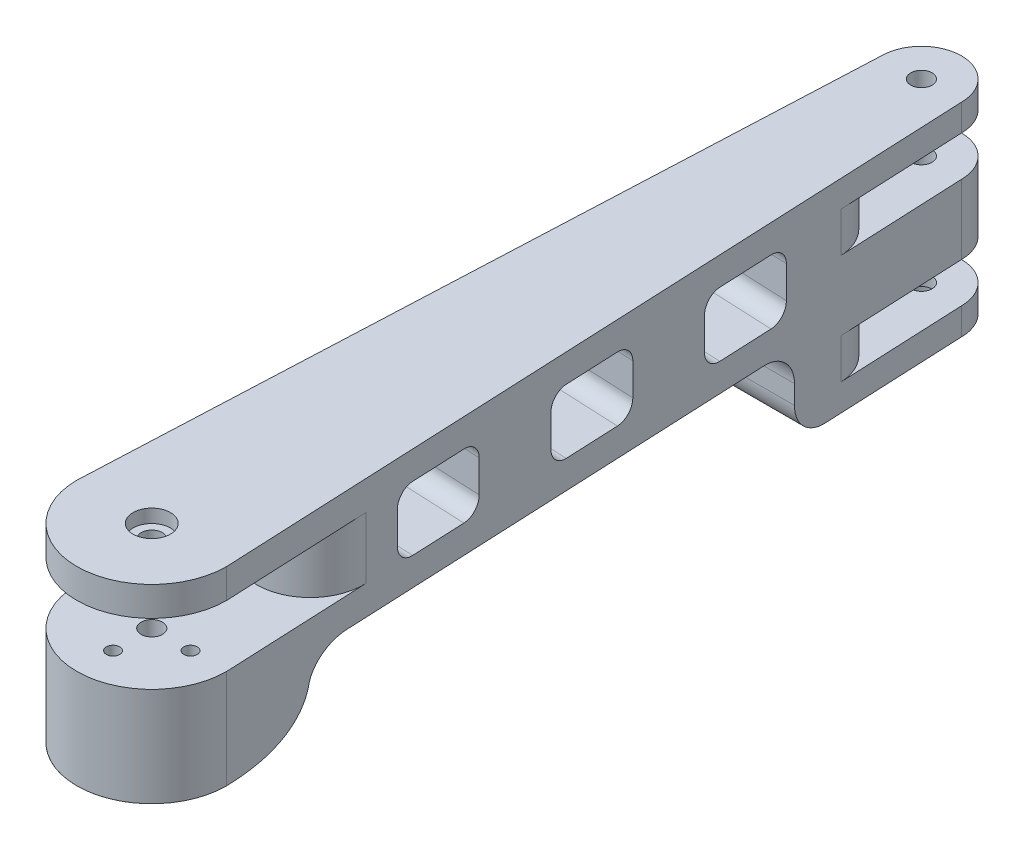
from build123d import *

# Parameters (mm, degrees)
BOSS_EXTRUDE1_DEPTH = 36
CUT_EXTRUDE1_START  = -5.5
SKETCH2_R           = 17
CUT_EXTRUDE1_DEPTH  = 11.5
FILLET1_R           = 10
SKETCH3_R           = 11
CUT_EXTRUDE2_DEPTH  = 5.6
SKETCH4_R           = 1.25
CUT_EXTRUDE3_DEPTH  = 13.4
SKETCH5_R           = 2
CUT_EXTRUDE4_DEPTH  = 156.152860109
CUT_EXTRUDE5_START  = -2.5
SKETCH6_R           = 3.5
SKETCH6_R_2         = 2
CUT_EXTRUDE5_DEPTH  = 2.5
CUT_EXTRUDE6_START  = -12.5
CUT_EXTRUDE6_DEPTH  = 7.5
LPATTERN1_COUNT     = 2
LPATTERN1_PITCH     = 20.5
SKETCH8_R           = 2
CUT_EXTRUDE7_DEPTH  = 157.346570157
FILLET2_R           = 9
CUT_EXTRUDE8_DEPTH  = 13.5
BOSS_EXTRUDE2_START = 2.039261455
BOSS_EXTRUDE2_DEPTH = 2.039261455
SKETCH15_R          = 2
CUT_EXTRUDE9_DEPTH  = 157.828681726
SKETCH17_R          = 3.5
SKETCH17_R_2        = 2
CUT_EXTRUDE10_DEPTH = 3
FILLET4_R           = 6
CUT_EXTRUDE11_DEPTH = 158.606994039


with BuildPart() as part:
    # Sketch1 → Boss-Extrude1 (new body)
    with BuildSketch(Plane(origin=(0, 0, 0), x_dir=(1, 0, 0), z_dir=(0, 1, 0))):
        with BuildLine():
            ThreePointArc((7.5, 144), (0, 151.5), (-7.5, 144))
            Line((-7.5, 144), (-14, 0))
            ThreePointArc((-14, 0), (0, -14), (14, 0))
            Line((14, 0), (7.5, 144))
        make_face()
    extrude(amount=BOSS_EXTRUDE1_DEPTH)

    # Sketch2 → Cut-Extrude1 (cut)
    with BuildSketch(Plane(origin=(0, 36, 0), x_dir=(1, 0, 0), z_dir=(0, 1, 0)).offset(CUT_EXTRUDE1_START)):
        Circle(SKETCH2_R)
    extrude(amount=-CUT_EXTRUDE1_DEPTH, mode=Mode.SUBTRACT)

    # Fillet1
    fillet1_edges = [part.edges().sort_by_distance(p)[0] for p in [
        (-13.535741066, 24.75, -10.28512099),
        (13.535741066, 24.75, -10.28512099),
    ]]
    fillet(fillet1_edges, radius=FILLET1_R)

    # Sketch3 → Cut-Extrude2 (cut)
    with BuildSketch(Plane.XZ):
        with Locations(Location((0, 0, 0), (0, 0, 270))):
            Circle(SKETCH3_R)
    extrude(amount=-CUT_EXTRUDE2_DEPTH, mode=Mode.SUBTRACT)

    # Sketch4 → Cut-Extrude3 (cut)
    with BuildSketch(Plane.XZ.offset(-5.6)):
        with Locations(Location((0, -7.25, 0), (0, 0, 270))):
            Circle(SKETCH4_R)
        with Locations(Location((-7.25, 0, 0), (0, 0, 270))):
            Circle(SKETCH4_R)
        with Locations(Location((0, 7.25, 0), (0, 0, 270))):
            Circle(SKETCH4_R)
        with Locations(Location((7.25, 0, 0), (0, 0, 270))):
            Circle(SKETCH4_R)
    extrude(amount=-CUT_EXTRUDE3_DEPTH, mode=Mode.SUBTRACT)

    # Sketch5 → Cut-Extrude4 (cut, through all)
    with BuildSketch(Plane.XZ.offset(-5.6)):
        with Locations(Location((0, 0, 0), (0, 0, 270))):
            Circle(SKETCH5_R)
    extrude(amount=-CUT_EXTRUDE4_DEPTH, mode=Mode.SUBTRACT)

    # Sketch6 → Cut-Extrude5 (cut)
    with BuildSketch(Plane(origin=(0, 36, 0), x_dir=(1, 0, 0), z_dir=(0, 1, 0)).offset(CUT_EXTRUDE5_START)):
        with Locations(Location((0, 0, 0), (0, 0, 270))):
            Circle(SKETCH6_R)
        with Locations(Location((0, 0, 0), (0, 0, 270))):
            Circle(SKETCH6_R_2, mode=Mode.SUBTRACT)
    extrude(amount=CUT_EXTRUDE5_DEPTH, mode=Mode.SUBTRACT)

    # Sketch7 → Cut-Extrude6 (cut)
    with BuildSketch(Plane(origin=(0, 36, 0), x_dir=(1, 0, 0), z_dir=(0, 1, 0)).offset(CUT_EXTRUDE6_START)):
        with BuildLine():
            Line((-7.5, 144), (-8.177083333, 129))
            Line((-8.177083333, 129), (8.177083333, 129))
            Line((8.177083333, 129), (7.5, 144))
            ThreePointArc((7.5, 144), (0, 151.5), (-7.5, 144))
        make_face()
    cut_extrude6 = extrude(amount=CUT_EXTRUDE6_DEPTH, mode=Mode.SUBTRACT)

    # LPattern1: Cut-Extrude6 ×2
    with Locations(*[(0, -i * LPATTERN1_PITCH, 0) for i in range(1, LPATTERN1_COUNT)]):
        add(cut_extrude6, mode=Mode.SUBTRACT)

    # Sketch8 → Cut-Extrude7 (cut, through all)
    with BuildSketch(Plane.XZ):
        with Locations(Location((0, -144, 0), (0, 0, 90))):
            Circle(SKETCH8_R)
    extrude(amount=-CUT_EXTRUDE7_DEPTH, mode=Mode.SUBTRACT)

    # Fillet2
    # the kernel refuses this fillet: 9 mm, written as the material it takes off along each edge
    with BuildSketch(Plane(origin=(-8.177083333, 1.992714572, -129), x_dir=(1, 0, 0), z_dir=(0, 1, 0))) as fillet2_piece_1_section:
        with BuildLine():
            CenterArc((FILLET2_R * 0.955879352349, -FILLET2_R), FILLET2_R, 90, 87.415486554)
            Line((-FILLET2_R * 0.0431034421745, -FILLET2_R * 0.954907026636), (0, 0))
            Line((0, 0), (FILLET2_R * 0.955879352349, 0))
        make_face()
    fillet2_piece_1 = extrude(amount=50.514570856, mode=Mode.PRIVATE)
    fillet2_piece_1 = split(fillet2_piece_1, bisect_by=Plane(origin=(-8.177083333, 3, -129), z_dir=(0, 1, 0)), keep=Keep.TOP, mode=Mode.PRIVATE)
    fillet2_piece_1 = split(fillet2_piece_1, bisect_by=Plane(origin=(-8.177083333, 10.5, -129), z_dir=(0, -1, 0)), keep=Keep.TOP, mode=Mode.PRIVATE)
    add(fillet2_piece_1, mode=Mode.SUBTRACT)
    with BuildSketch(Plane(origin=(-8.177083333, 23.5, -129), x_dir=(1, 0, 0), z_dir=(0, 1, 0)), Plane(origin=(-8.177083333, 3, -129), x_dir=(1, 0, 0), z_dir=(0, 1, 0)), Plane(origin=(8.177083333, 23.5, -129), x_dir=(0.04509297336389057, 0, 0.9989827945231107), z_dir=(0, 1, 0)), Plane(origin=(8.177083333, 3, -129), x_dir=(0.04509297336389057, 0, 0.9989827945231107), z_dir=(0, 1, 0))) as fillet2_piece_2:
        with BuildLine():
            CenterArc((FILLET2_R * 0.955879352349, -FILLET2_R), FILLET2_R, 90, 87.415486554)
            Line((-FILLET2_R * 0.0431034421745, -FILLET2_R * 0.954907026636), (0, 0))
            Line((0, 0), (FILLET2_R * 0.955879352349, 0))
        make_face()
    extrude(amount=7.5, mode=Mode.SUBTRACT)
    with BuildSketch(Plane(origin=(-8.177083333, -18.507285428, -129), x_dir=(1, 0, 0), z_dir=(0, 1, 0))) as fillet2_piece_3_section:
        with BuildLine():
            CenterArc((FILLET2_R * 0.955879352349, -FILLET2_R), FILLET2_R, 90, 87.415486554)
            Line((-FILLET2_R * 0.0431034421745, -FILLET2_R * 0.954907026636), (0, 0))
            Line((0, 0), (FILLET2_R * 0.955879352349, 0))
        make_face()
    fillet2_piece_3 = extrude(amount=50.514570856, mode=Mode.PRIVATE)
    fillet2_piece_3 = split(fillet2_piece_3, bisect_by=Plane(origin=(-8.177083333, 23.5, -129), z_dir=(0, 1, 0)), keep=Keep.TOP, mode=Mode.PRIVATE)
    fillet2_piece_3 = split(fillet2_piece_3, bisect_by=Plane(origin=(-8.177083333, 31, -129), z_dir=(0, -1, 0)), keep=Keep.TOP, mode=Mode.PRIVATE)
    add(fillet2_piece_3, mode=Mode.SUBTRACT)
    with BuildSketch(Plane(origin=(8.177083333, 1.992714572, -129), x_dir=(0.04509297336389057, 0, 0.9989827945231107), z_dir=(0, 1, 0))) as fillet2_piece_4_section:
        with BuildLine():
            CenterArc((FILLET2_R * 0.955879352349, -FILLET2_R), FILLET2_R, 90, 87.415486554)
            Line((-FILLET2_R * 0.0431034421745, -FILLET2_R * 0.954907026636), (0, 0))
            Line((0, 0), (FILLET2_R * 0.955879352349, 0))
        make_face()
    fillet2_piece_4 = extrude(amount=50.514570856, mode=Mode.PRIVATE)
    fillet2_piece_4 = split(fillet2_piece_4, bisect_by=Plane(origin=(8.177083333, 3, -129), z_dir=(0, 1, 0)), keep=Keep.TOP, mode=Mode.PRIVATE)
    fillet2_piece_4 = split(fillet2_piece_4, bisect_by=Plane(origin=(8.177083333, 10.5, -129), z_dir=(0, -1, 0)), keep=Keep.TOP, mode=Mode.PRIVATE)
    add(fillet2_piece_4, mode=Mode.SUBTRACT)
    with BuildSketch(Plane(origin=(8.177083333, -18.507285428, -129), x_dir=(0.04509297336389057, 0, 0.9989827945231107), z_dir=(0, 1, 0))) as fillet2_piece_5_section:
        with BuildLine():
            CenterArc((FILLET2_R * 0.955879352349, -FILLET2_R), FILLET2_R, 90, 87.415486554)
            Line((-FILLET2_R * 0.0431034421745, -FILLET2_R * 0.954907026636), (0, 0))
            Line((0, 0), (FILLET2_R * 0.955879352349, 0))
        make_face()
    fillet2_piece_5 = extrude(amount=50.514570856, mode=Mode.PRIVATE)
    fillet2_piece_5 = split(fillet2_piece_5, bisect_by=Plane(origin=(8.177083333, 23.5, -129), z_dir=(0, 1, 0)), keep=Keep.TOP, mode=Mode.PRIVATE)
    fillet2_piece_5 = split(fillet2_piece_5, bisect_by=Plane(origin=(8.177083333, 31, -129), z_dir=(0, -1, 0)), keep=Keep.TOP, mode=Mode.PRIVATE)
    add(fillet2_piece_5, mode=Mode.SUBTRACT)

    # Sketch9 → Cut-Extrude8 (cut)
    with BuildSketch(Plane.XZ):
        with BuildLine():
            Line((8.977561109, -111.266338499), (-8.977561109, -111.266338499))
            Line((-8.977561109, -111.266338499), (-13.265142213, -16.279926353))
            ThreePointArc((-13.265142213, -16.279926353), (0, -21), (13.265142213, -16.279926353))
            Line((13.265142213, -16.279926353), (8.977561109, -111.266338499))
        make_face()
    extrude(amount=-CUT_EXTRUDE8_DEPTH, mode=Mode.SUBTRACT)

    # Sketch10 → Boss-Extrude2 (add)
    with BuildSketch(Plane.XZ.offset(BOSS_EXTRUDE2_START)):
        with BuildLine():
            Line((7.5, -144), (8.977561109, -111.266338499))
            Line((8.977561109, -111.266338499), (-8.977561109, -111.266338499))
            Line((-8.977561109, -111.266338499), (-7.5, -144))
            ThreePointArc((-7.5, -144), (0, -151.5), (7.5, -144))
        make_face()
    extrude(amount=-BOSS_EXTRUDE2_DEPTH)

    # Sketch15 → Cut-Extrude9 (cut, through all)
    with BuildSketch(Plane(origin=(0, 36, 0), x_dir=(1, 0, 0), z_dir=(0, 1, 0))):
        with Locations(Location((0, 144, 0), (0, 0, 270))):
            Circle(SKETCH15_R)
    extrude(amount=-CUT_EXTRUDE9_DEPTH, mode=Mode.SUBTRACT)

    # Sketch17 → Cut-Extrude10 (cut)
    with BuildSketch(Plane.XZ.offset(2.039261455)):
        with Locations(Location((0, -144, 0), (0, 0, 270))):
            Circle(SKETCH17_R)
        with Locations(Location((0, -144, 0), (0, 0, 270))):
            Circle(SKETCH17_R_2, mode=Mode.SUBTRACT)
    extrude(amount=-CUT_EXTRUDE10_DEPTH, mode=Mode.SUBTRACT)

    # Fillet3: read off the stored shape, not the designer's step
    # Fillet3 outline → Fillet3 (revolve, cut)
    with BuildSketch(Plane.XY):
        with BuildLine():
            ThreePointArc((21, 10), (18.071067812, 2.928932188), (11, 0))
            Line((11, 0), (21, 0))
            Line((21, 0), (21, 10))
        make_face()
    revolve(axis=Axis((0, 0, 0), (0, 1, 0)), mode=Mode.SUBTRACT)

    # Fillet4
    fillet4_edges = [part.edges().sort_by_distance(p)[0] for p in [
        (0, 13.5, -21),
        (0, 13.5, -111.266338499),
        (0, -2.039261455, -111.266338499),
    ]]
    fillet(fillet4_edges, radius=FILLET4_R)

    # Sketch18 → Cut-Extrude11 (cut, through all)
    with BuildSketch(Plane(origin=(-13.971532733, 0, -0.630659464), x_dir=(-0.04509297336389045, 0, 0.9989827945231107), z_dir=(-0.9989827945231108, 0, -0.04509297336389045))):
        with BuildLine():
            Line((-79.983553336, 21.75), (-79.983553336, 27.75))
            ThreePointArc((-79.983553336, 27.75), (-79.10487368, 29.871320344), (-76.983553336, 30.75))
            Line((-76.983553336, 30.75), (-66.983553336, 30.75))
            ThreePointArc((-66.983553336, 30.75), (-64.862232993, 29.871320344), (-63.983553336, 27.75))
            Line((-63.983553336, 27.75), (-63.983553336, 21.75))
            ThreePointArc((-63.983553336, 21.75), (-64.862232993, 19.628679656), (-66.983553336, 18.75))
            Line((-66.983553336, 18.75), (-76.983553336, 18.75))
            ThreePointArc((-76.983553336, 18.75), (-79.10487368, 19.628679656), (-79.983553336, 21.75))
        make_face()
        with BuildLine():
            Line((-106.983553336, 18.75), (-96.983553336, 18.75))
            ThreePointArc((-96.983553336, 18.75), (-94.862232993, 19.628679656), (-93.983553336, 21.75))
            Line((-93.983553336, 21.75), (-93.983553336, 27.75))
            ThreePointArc((-93.983553336, 27.75), (-94.862232993, 29.871320344), (-96.983553336, 30.75))
            Line((-96.983553336, 30.75), (-106.983553336, 30.75))
            ThreePointArc((-106.983553336, 30.75), (-109.10487368, 29.871320344), (-109.983553336, 27.75))
            Line((-109.983553336, 27.75), (-109.983553336, 21.75))
            ThreePointArc((-109.983553336, 21.75), (-109.10487368, 19.628679656), (-106.983553336, 18.75))
        make_face()
        with BuildLine():
            Line((-49.983553336, 21.75), (-49.983553336, 27.75))
            ThreePointArc((-49.983553336, 27.75), (-49.10487368, 29.871320344), (-46.983553336, 30.75))
            Line((-46.983553336, 30.75), (-36.983553336, 30.75))
            ThreePointArc((-36.983553336, 30.75), (-34.862232993, 29.871320344), (-33.983553336, 27.75))
            Line((-33.983553336, 27.75), (-33.983553336, 21.75))
            ThreePointArc((-33.983553336, 21.75), (-34.862232993, 19.628679656), (-36.983553336, 18.75))
            Line((-36.983553336, 18.75), (-46.983553336, 18.75))
            ThreePointArc((-46.983553336, 18.75), (-49.10487368, 19.628679656), (-49.983553336, 21.75))
        make_face()
    extrude(amount=-CUT_EXTRUDE11_DEPTH, mode=Mode.SUBTRACT)


solid = part.part
